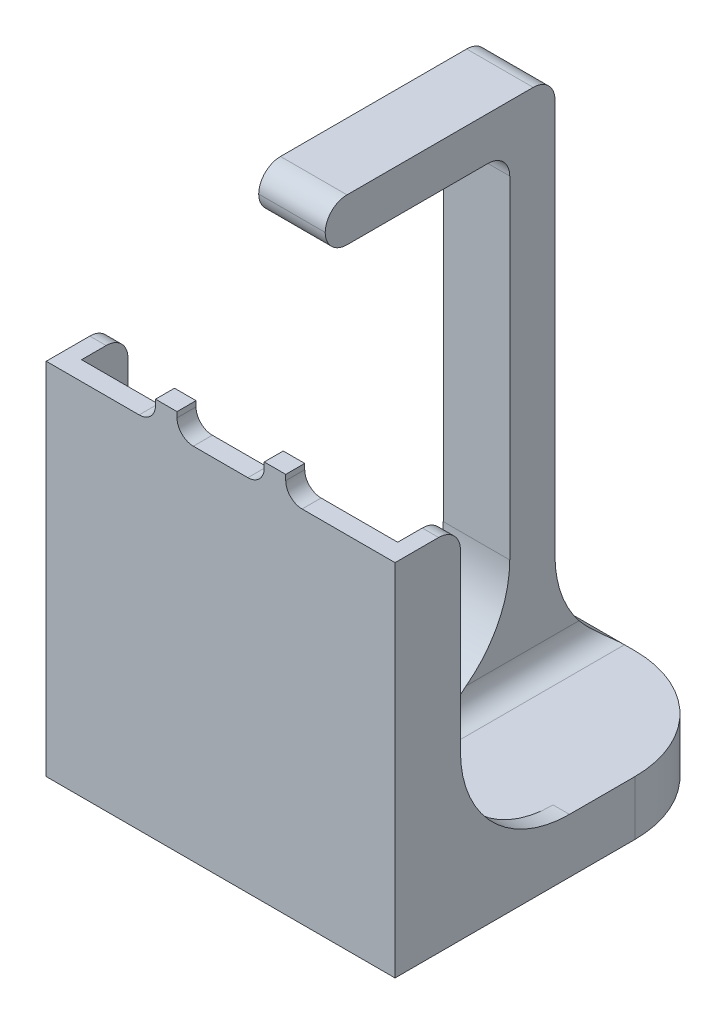
from build123d import *

# Parameters (mm, degrees)
SKETCH1_W           = 32
SKETCH1_H           = 32
BOSS_EXTRUDE1_DEPTH = 5
BOSS_EXTRUDE5_DEPTH = 28
SKETCH6_W           = 6.1
SKETCH6_H           = 4.005404858
CUT_EXTRUDE2_DEPTH  = 24
SKETCH7_W           = 1.973672473
SKETCH7_H           = 2
BOSS_EXTRUDE6_DEPTH = 1.742972258
FILLET1_R           = 1.5
SKETCH8_W           = 6.1
SKETCH8_H           = 4.149014421
BOSS_EXTRUDE7_DEPTH = 42.5
SKETCH9_W           = 6.1
SKETCH9_H           = 3.972443091
BOSS_EXTRUDE8_DEPTH = 16.930897648
SKETCH10_W          = 6.1
SKETCH10_H          = 3.972443091
BOSS_EXTRUDE9_DEPTH = 4.149014421
FILLET3_R           = 2
FILLET5_R           = 10
FILLET6_R           = 2
FILLET7_R           = 10


with BuildPart() as part:
    # Sketch1 → Boss-Extrude1 (new body)
    with BuildSketch(Plane(origin=(0, 0, 0), x_dir=(1, 0, 0), z_dir=(0, 1, 0))):
        Rectangle(SKETCH1_W, SKETCH1_H)
    extrude(amount=BOSS_EXTRUDE1_DEPTH)

    # Sketch2 → Boss-Extrude5 (add)
    with BuildSketch(Plane(origin=(0, 5, 0), x_dir=(1, 0, 0), z_dir=(0, 1, 0))):
        Polygon((3.05, -5.451622884), (-3.05, -5.451622884), (-3.05, -9.457027742), (0, -9.457027742), (3.05, -9.457027742), align=None)
        Polygon((-14.5, -16), (0, -16), (14.5, -16), (16, -16), (16, -10), (14.5, -10), (14.5, -14.257027742), (0, -14.257027742), (-14.5, -14.257027742), (-14.5, -10), (-16, -10), (-16, -16), align=None)
    extrude(amount=BOSS_EXTRUDE5_DEPTH)

    # Sketch6 → Cut-Extrude2 (cut)
    with BuildSketch(Plane(origin=(0, 33, 0), x_dir=(1, 0, 0), z_dir=(0, 1, 0))):
        with Locations((0, -7.454325313)):
            Rectangle(SKETCH6_W, SKETCH6_H)
    extrude(amount=-CUT_EXTRUDE2_DEPTH, mode=Mode.SUBTRACT)

    # Sketch7 → Boss-Extrude6 (add)
    with BuildSketch(Plane.XY.offset(16)):
        with Locations((-4.986836237, 34)):
            Rectangle(SKETCH7_W, SKETCH7_H)
        with Locations((4.986836237, 34)):
            Rectangle(SKETCH7_W, SKETCH7_H)
    extrude(amount=-BOSS_EXTRUDE6_DEPTH)

    # Fillet1
    fillet1_edges = [part.edges().sort_by_distance(p)[0] for p in [
        (-5.973672473, 33, 15.128513871),
        (-4, 33, 15.128513871),
        (5.973672473, 33, 15.128513871),
        (4, 33, 15.128513871),
    ]]
    fillet(fillet1_edges, radius=FILLET1_R)

    # Sketch8 → Boss-Extrude7 (add)
    with BuildSketch(Plane(origin=(0, 5, 0), x_dir=(1, 0, 0), z_dir=(0, 1, 0))):
        with Locations((0, 9.548377117)):
            Rectangle(SKETCH8_W, SKETCH8_H)
    extrude(amount=BOSS_EXTRUDE7_DEPTH)



with BuildPart() as body_2:
    # Sketch9 → Boss-Extrude8 (new body)
    with BuildSketch(Plane.XY.offset(-7.473869906)):
        with Locations((0, 49.486221546)):
            Rectangle(SKETCH9_W, SKETCH9_H)
    extrude(amount=BOSS_EXTRUDE8_DEPTH)


with BuildPart() as part_1:
    add(part.part)

    add(body_2.part)  # Boss-Extrude9 merges body 2
    # Sketch10 → Boss-Extrude9 (add)
    with BuildSketch(Plane(origin=(0, 0, -7.473869906), x_dir=(-1, 0, 0), z_dir=(0, 0, -1))):
        with Locations((0, 49.486221546)):
            Rectangle(SKETCH10_W, SKETCH10_H)
    extrude(amount=BOSS_EXTRUDE9_DEPTH)

    # Fillet3
    # the kernel refuses this fillet: 2 mm, written as the material it adds along each edge
    with BuildSketch(Plane(origin=(3.05, 47.5, -7.473869906), x_dir=(0, 0, 1), z_dir=(-1, 0, 0))) as fillet3_piece_1:
        with BuildLine():
            CenterArc((FILLET3_R, -FILLET3_R), FILLET3_R, 90, 90)
            Line((0, -FILLET3_R), (0, 0))
            Line((0, 0), (FILLET3_R, 0))
        make_face()
    extrude(amount=6.1)
    # the kernel refuses this fillet: 2 mm, written as the material it takes off along each edge
    with BuildSketch(Plane(origin=(8.05, 51.472443091, -11.622884327), x_dir=(0, -1, 0), z_dir=(-1, 0, 0)), Plane(origin=(-8.05, 51.472443091, 9.457027742), x_dir=(0, -1, 0), z_dir=(1, 0, 0))) as fillet3_2_piece_1:
        with BuildLine():
            CenterArc((FILLET3_R, FILLET3_R), FILLET3_R, 180, 90)
            Line((0, FILLET3_R), (0, 0))
            Line((0, 0), (FILLET3_R, 0))
        make_face()
    extrude(amount=16.1, mode=Mode.SUBTRACT)
    with BuildSketch(Plane(origin=(8.05, 47.5, 9.457027742), x_dir=(0, 0, -1), z_dir=(-1, 0, 0)), Plane(origin=(-8.05, 9, 5.451622884), x_dir=(0, -1, 0), z_dir=(1, 0, 0)), Plane(origin=(8.05, 9, 9.457027742), x_dir=(0, -1, 0), z_dir=(-1, 0, 0))) as fillet3_2_piece_2:
        with BuildLine():
            CenterArc((FILLET3_R, -FILLET3_R), FILLET3_R, 90, 90)
            Line((0, -FILLET3_R), (0, 0))
            Line((0, 0), (FILLET3_R, 0))
        make_face()
    extrude(amount=16.1, mode=Mode.SUBTRACT)
    with BuildSketch(Plane(origin=(21, 33, 10), x_dir=(0, 0, 1), z_dir=(-1, 0, 0)), Plane(origin=(-9.5, 33, 10), x_dir=(0, 0, 1), z_dir=(-1, 0, 0))) as fillet3_2_piece_3:
        with BuildLine():
            CenterArc((FILLET3_R, -FILLET3_R), FILLET3_R, 90, 90)
            Line((0, -FILLET3_R), (0, 0))
            Line((0, 0), (FILLET3_R, 0))
        make_face()
    extrude(amount=11.5, mode=Mode.SUBTRACT)

    # Fillet5
    # the kernel refuses this fillet: 10 mm, written as the material it adds along each edge
    with BuildSketch(Plane(origin=(-3.05, 5, -7.473869906), x_dir=(0, 1, 0), z_dir=(1, 0, 0))) as fillet5_piece_1:
        with BuildLine():
            CenterArc((FILLET5_R, FILLET5_R), FILLET5_R, 180, 90)
            Line((0, FILLET5_R), (-FILLET5_R * 0.02, FILLET5_R))
            Line((-FILLET5_R * 0.02, FILLET5_R), (-FILLET5_R * 0.02, -FILLET5_R * 0.02))
            Line((-FILLET5_R * 0.02, -FILLET5_R * 0.02), (FILLET5_R, -FILLET5_R * 0.02))
            Line((FILLET5_R, -FILLET5_R * 0.02), (FILLET5_R, 0))
        make_face()
    extrude(amount=6.1)
    with BuildSketch(Plane(origin=(3.05, 5, -11.622884327), x_dir=(0, 0, -1), z_dir=(-1, 0, 0))) as fillet5_piece_2:
        with BuildLine():
            CenterArc((10, -8.26941182), FILLET5_R, 124.214206314, 55.785793686)
            Line((0, -8.26941182), (-0.2, -8.26941182))
            Line((-0.2, -8.26941182), (-0.2, 0))
            Line((-0.2, 0), (0, 0.2))
            ThreePointArc((0, 0.2), (2.188557837, 0.2), (4.264657987, 0.165388236))
            Line((4.264657987, 0.165388236), (4.377115673, 0))
        make_face()
    extrude(amount=6.1)
    with BuildSketch(Plane(origin=(-14.5, 5, 10), x_dir=(0, 0, -1), z_dir=(-1, 0, 0)), Plane(origin=(16, 5, 10), x_dir=(0, 0, -1), z_dir=(-1, 0, 0))) as fillet5_piece_3:
        with BuildLine():
            CenterArc((FILLET5_R, -FILLET5_R), FILLET5_R, 90, 90)
            Line((0, -FILLET5_R), (-FILLET5_R * 0.02, -FILLET5_R))
            Line((-FILLET5_R * 0.02, -FILLET5_R), (-FILLET5_R * 0.02, FILLET5_R * 0.02))
            Line((-FILLET5_R * 0.02, FILLET5_R * 0.02), (FILLET5_R, FILLET5_R * 0.02))
            Line((FILLET5_R, FILLET5_R * 0.02), (FILLET5_R, 0))
        make_face()
    extrude(amount=1.5)

    # Fillet6
    fillet6_edges = [part_1.edges().sort_by_distance(p)[0] for p in [
        (-3.05, 5, -6.736934953),
        (-3.05, 5, 7.454325313),
        (3.05, 5, -6.736934953),
        (3.05, 5, 7.454325313),
    ]]
    fillet(fillet6_edges, radius=FILLET6_R)

    # Fillet7
    fillet7_edges = [part_1.edges().sort_by_distance(p)[0] for p in [
        (-16, 2.5, -16),
        (16, 2.5, -16),
    ]]
    fillet(fillet7_edges, radius=FILLET7_R)


solid = part_1.part
